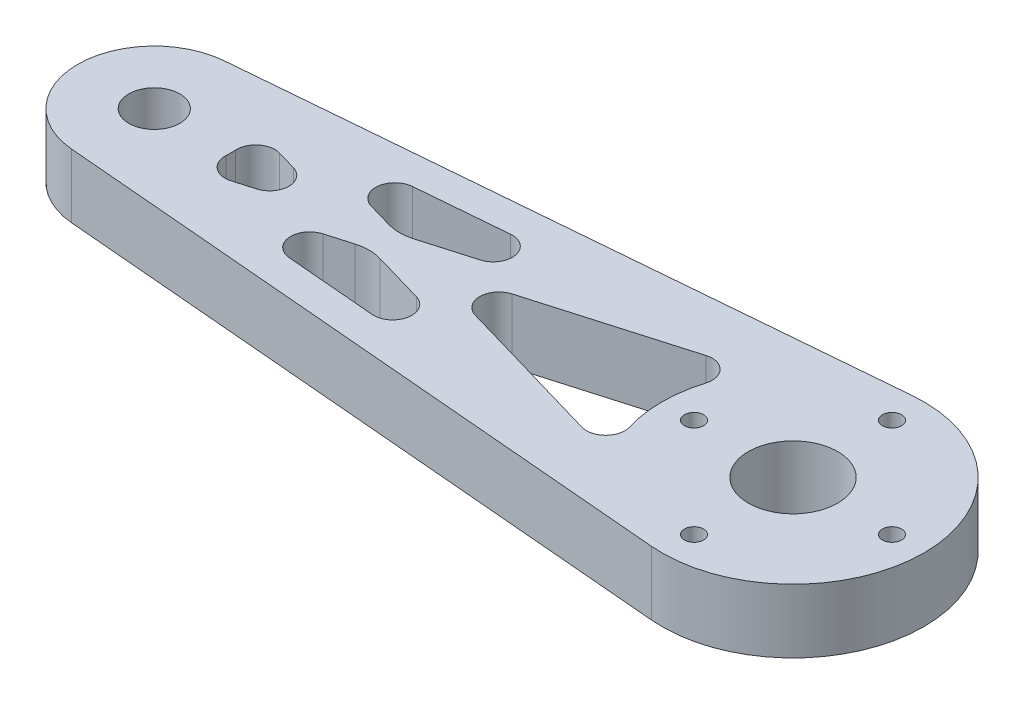
from build123d import *

# Parameters (mm, degrees)
SKETCH1_R           = 7
SKETCH1_R_2         = 4
BOSS_EXTRUDE1_DEPTH = 10
SKETCH2_R           = 1.5
CUT_EXTRUDE1_DEPTH  = 10


with BuildPart() as part:
    # Sketch1 → Boss-Extrude1 (new body)
    with BuildSketch(Plane(origin=(0, 0, 0), x_dir=(1, 0, 0), z_dir=(0, 1, 0))):
        with BuildLine():
            Line((-1.7425, -20.4258095), (-101.02, -11.956571415))
            ThreePointArc((-101.02, -11.956571415), (-112, 0), (-101.02, 11.956571415))
            Line((-101.02, 11.956571415), (-1.7425, 20.4258095))
            ThreePointArc((-1.7425, 20.4258095), (20.5, 0), (-1.7425, -20.4258095))
        make_face()
        Circle(SKETCH1_R, mode=Mode.SUBTRACT)
        with Locations((-100, 0)):
            Circle(SKETCH1_R_2, mode=Mode.SUBTRACT)
        with BuildLine():
            Line((-84.191001334, -3.779047898), (-81.096242799, -2.881194367))
            ThreePointArc((-81.096242799, -2.881194367), (-78.932136943, 0), (-81.096242799, 2.881194367))
            Line((-81.096242799, 2.881194367), (-84.191001334, 3.779047898))
            ThreePointArc((-84.191001334, 3.779047898), (-86.899619701, 3.241548046), (-88.021516382, 0.718282824))
            ThreePointArc((-88.021516382, 0.718282824), (-88, 0), (-88.021516382, -0.718282824))
            ThreePointArc((-88.021516382, -0.718282824), (-86.899619701, -3.241548046), (-84.191001334, -3.779047898))
        make_face(mode=Mode.SUBTRACT)
        with BuildLine():
            Line((-69.832249651, -3.778216146), (-65.93770065, -2.648326841))
            ThreePointArc((-65.93770065, -2.648326841), (-63.987280982, -2.371113698), (-62.036861314, -2.648326841))
            Line((-62.036861314, -2.648326841), (-53.969530614, -4.988826518))
            ThreePointArc((-53.969530614, -4.988826518), (-51.855920685, -8.418131938), (-55.060424757, -10.859163739))
            Line((-55.060424757, -10.859163739), (-69.251355507, -9.648553367))
            ThreePointArc((-69.251355507, -9.648553367), (-71.98177462, -6.95483008), (-69.832249651, -3.778216146))
        make_face(mode=Mode.SUBTRACT)
        with BuildLine():
            Line((-46.878319164, -2.881194367), (-23.320026626, -9.715942825))
            ThreePointArc((-23.320026626, -9.715942825), (-20.349346369, -8.942517006), (-19.613817698, -5.962227378))
            ThreePointArc((-19.613817698, -5.962227378), (-20.5, 0), (-19.613817698, 5.962227378))
            ThreePointArc((-19.613817698, 5.962227378), (-20.349346369, 8.942517006), (-23.320026626, 9.715942825))
            Line((-23.320026626, 9.715942825), (-46.878319164, 2.881194367))
            ThreePointArc((-46.878319164, 2.881194367), (-49.042425021, 0), (-46.878319164, -2.881194367))
        make_face(mode=Mode.SUBTRACT)
        with BuildLine():
            Line((-62.036861314, 2.648326841), (-53.969530614, 4.988826518))
            ThreePointArc((-53.969530614, 4.988826518), (-51.855920685, 8.418131938), (-55.060424757, 10.859163739))
            Line((-55.060424757, 10.859163739), (-69.251355507, 9.648553367))
            ThreePointArc((-69.251355507, 9.648553367), (-71.98177462, 6.95483008), (-69.832249651, 3.778216146))
            Line((-69.832249651, 3.778216146), (-65.93770065, 2.648326841))
            ThreePointArc((-65.93770065, 2.648326841), (-63.987280982, 2.371113698), (-62.036861314, 2.648326841))
        make_face(mode=Mode.SUBTRACT)
    extrude(amount=BOSS_EXTRUDE1_DEPTH)

    # Sketch2 → Cut-Extrude1 (cut)
    with BuildSketch(Plane(origin=(0, 10, 0), x_dir=(1, 0, 0), z_dir=(0, 1, 0))):
        with Locations((-15.5, 0)):
            Circle(SKETCH2_R)
        with Locations((0, 15.5)):
            Circle(SKETCH2_R)
        with Locations((15.5, 0)):
            Circle(SKETCH2_R)
        with Locations((0, -15.5)):
            Circle(SKETCH2_R)
    extrude(amount=-CUT_EXTRUDE1_DEPTH, mode=Mode.SUBTRACT)


solid = part.part
